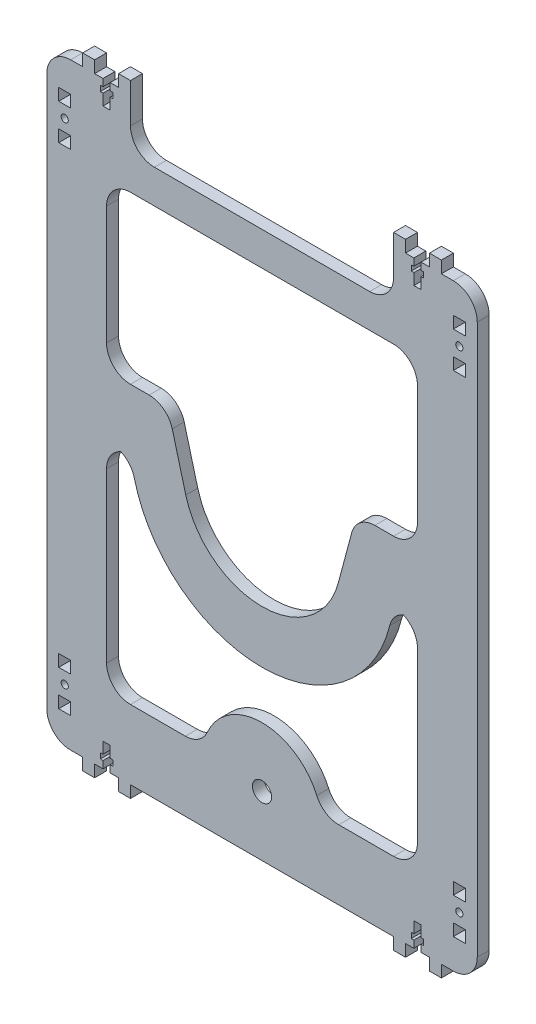
from build123d import *

# Parameters (mm, degrees)
SKETCH1_W           = 5
SKETCH1_H           = 5
SKETCH1_R           = 1.5
SKETCH1_R_2         = 4
BOSS_EXTRUDE1_DEPTH = 5
FILLET1_R           = 10


with BuildPart() as part:
    # Sketch1 → Boss-Extrude1 (new body)
    with BuildSketch(Plane.XY):
        Polygon((-75, 125), (-90, 125), (-90, -125), (-75, -125), (-75, -130), (-70, -130), (-70, -125), (-66.5, -125), (-66.5, -122), (-67.6, -122), (-67.6, -119.7), (-66.5, -119.7), (-66.5, -115), (-63.5, -115), (-63.5, -119.7), (-62.4, -119.7), (-62.4, -122), (-63.5, -122), (-63.5, -125), (-60, -125), (-60, -130), (-55, -130), (-55, -125), (55, -125), (55, -130), (60, -130), (60, -125), (63.5, -125), (63.5, -122), (62.4, -122), (62.4, -119.7), (63.5, -119.7), (63.5, -115), (66.5, -115), (66.5, -119.7), (67.6, -119.7), (67.6, -122), (66.5, -122), (66.5, -125), (70, -125), (70, -130), (75, -130), (75, -125), (90, -125), (90, 125), (75, 125), (75, 130), (70, 130), (70, 125), (66.5, 125), (66.5, 122), (67.6, 122), (67.6, 119.7), (66.5, 119.7), (66.5, 115), (63.5, 115), (63.5, 119.7), (62.4, 119.7), (62.4, 122), (63.5, 122), (63.5, 125), (60, 125), (60, 130), (55, 130), (55, 103.598832104), (-55, 103.598832104), (-55, 130), (-60, 130), (-60, 125), (-63.5, 125), (-63.5, 122), (-62.4, 122), (-62.4, 119.7), (-63.5, 119.7), (-63.5, 115), (-66.5, 115), (-66.5, 119.7), (-67.6, 119.7), (-67.6, 122), (-66.5, 122), (-66.5, 125), (-70, 125), (-70, 130), (-75, 130), align=None)
        with Locations((-82.5, -110)):
            Rectangle(SKETCH1_W, SKETCH1_H, mode=Mode.SUBTRACT)
        with Locations((-82.5, -102.5)):
            Circle(SKETCH1_R, mode=Mode.SUBTRACT)
        with Locations((-82.5, -95)):
            Rectangle(SKETCH1_W, SKETCH1_H, mode=Mode.SUBTRACT)
        with Locations((0, -100)):
            Circle(SKETCH1_R_2, mode=Mode.SUBTRACT)
        with Locations((82.5, -110)):
            Rectangle(SKETCH1_W, SKETCH1_H, mode=Mode.SUBTRACT)
        with Locations((82.5, -102.5)):
            Circle(SKETCH1_R, mode=Mode.SUBTRACT)
        with Locations((82.5, -95)):
            Rectangle(SKETCH1_W, SKETCH1_H, mode=Mode.SUBTRACT)
        with BuildLine():
            Line((-65, -5.570672252), (-54.717160111, -5.570672252))
            ThreePointArc((-54.717160111, -5.570672252), (0, -55), (54.717160111, -5.570672252))
            Line((54.717160111, -5.570672252), (65, -5.570672252))
            Line((65, -5.570672252), (65, -95.958016924))
            Line((65, -95.958016924), (24.671083738, -95.958016924))
            ThreePointArc((24.671083738, -95.958016924), (0, -75), (-24.671083738, -95.958016924))
            Line((-24.671083738, -95.958016924), (-65, -95.958016924))
            Line((-65, -95.958016924), (-65, -5.570672252))
        make_face(mode=Mode.SUBTRACT)
        with Locations((-82.5, 95)):
            Rectangle(SKETCH1_W, SKETCH1_H, mode=Mode.SUBTRACT)
        with Locations((-82.5, 102.5)):
            Circle(SKETCH1_R, mode=Mode.SUBTRACT)
        with Locations((-82.5, 110)):
            Rectangle(SKETCH1_W, SKETCH1_H, mode=Mode.SUBTRACT)
        with BuildLine():
            ThreePointArc((31.875552268, -8.541028488), (0, -33), (-31.875552268, -8.541028488))
            Line((-31.875552268, -8.541028488), (-39.523097802, 20))
            Line((-39.523097802, 20), (-65, 20))
            Line((-65, 20), (-65, 89.539551807))
            Line((-65, 89.539551807), (65, 89.539551807))
            Line((65, 89.539551807), (65, 20))
            Line((65, 20), (39.523097802, 20))
            Line((39.523097802, 20), (31.875552268, -8.541028488))
        make_face(mode=Mode.SUBTRACT)
        with Locations((82.5, 95)):
            Rectangle(SKETCH1_W, SKETCH1_H, mode=Mode.SUBTRACT)
        with Locations((82.5, 102.5)):
            Circle(SKETCH1_R, mode=Mode.SUBTRACT)
        with Locations((82.5, 110)):
            Rectangle(SKETCH1_W, SKETCH1_H, mode=Mode.SUBTRACT)
    extrude(amount=BOSS_EXTRUDE1_DEPTH)

    # Fillet1
    # the kernel refuses this fillet: 10 mm, written as the material it adds along each edge
    with BuildSketch(Plane(origin=(-55, 103.598832104, 0), x_dir=(1, 0, 0), z_dir=(0, 0, 1)), Plane(origin=(55, 103.598832104, 0), x_dir=(0, 1, 0), z_dir=(0, 0, 1)), Plane(origin=(-65, -95.958016924, 0), x_dir=(1, 0, 0), z_dir=(0, 0, 1)), Plane(origin=(65, -95.958016924, 0), x_dir=(0, 1, 0), z_dir=(0, 0, 1)), Plane(origin=(65, -5.570672252, 0), x_dir=(-1, 0, 0), z_dir=(0, 0, 1)), Plane(origin=(-65, -5.570672252, 0), x_dir=(0, -1, 0), z_dir=(0, 0, 1)), Plane(origin=(65, 89.539551807, 0), x_dir=(-1, 0, 0), z_dir=(0, 0, 1)), Plane(origin=(-65, 89.539551807, 0), x_dir=(0, -1, 0), z_dir=(0, 0, 1)), Plane(origin=(65, 20, 0), x_dir=(0, 1, 0), z_dir=(0, 0, 1)), Plane(origin=(-65, 20, 0), x_dir=(1, 0, 0), z_dir=(0, 0, 1))) as fillet1_piece_1:
        with BuildLine():
            CenterArc((FILLET1_R, FILLET1_R), FILLET1_R, 180, 90)
            Line((0, FILLET1_R), (0, 0))
            Line((0, 0), (FILLET1_R, 0))
        make_face()
    extrude(amount=5)
    with BuildSketch(Plane(origin=(24.671083738, -95.958016924, 0), x_dir=(1, 0, 0), z_dir=(0, 0, 1))) as fillet1_piece_2:
        with BuildLine():
            CenterArc((7.388590485, 10), FILLET1_R, 203.653187484, 66.346812516)
            ThreePointArc((-1.771316436, 5.988004835), (-0.697963006, 3.049524687), (0, 0))
            Line((0, 0), (7.388590485, 0))
        make_face()
    extrude(amount=5)
    with BuildSketch(Plane(origin=(-24.671083738, -95.958016924, 0), x_dir=(-1, 0, 0), z_dir=(0, 0, 1))) as fillet1_piece_3:
        with BuildLine():
            CenterArc((7.388590485, -10), FILLET1_R, 90, 66.346812516)
            ThreePointArc((-1.771316436, -5.988004835), (-0.697963006, -3.049524687), (0, 0))
            Line((0, 0), (7.388590485, 0))
        make_face()
    extrude(amount=5)
    with BuildSketch(Plane(origin=(54.717160111, -5.570672252, 0), x_dir=(-0.17083790481511615, -0.9852991476086749, 0), z_dir=(0, 0, 1))) as fillet1_piece_4:
        with BuildLine():
            CenterArc((8.419606625, 9.975355126), FILLET1_R, 189.836540175, 76.140088059)
            Line((-1.433384851, 8.266976078), (0, 0))
            ThreePointArc((0, 0), (3.85898637, 0.135546807), (7.717972739, 0))
        make_face()
    extrude(amount=5)
    with BuildSketch(Plane(origin=(-54.717160111, -5.570672252, 0), x_dir=(-1, 0, 0), z_dir=(0, 0, 1))) as fillet1_piece_5:
        with BuildLine():
            CenterArc((8.390320948, 10), FILLET1_R, 193.859911941, 76.140088059)
            ThreePointArc((-1.318522292, 7.604511961), (-0.525706993, 3.825412513), (0, 0))
            Line((0, 0), (8.390320948, 0))
        make_face()
    extrude(amount=5)
    # the kernel refuses this fillet: 10 mm, written as the material it takes off along each edge
    with BuildSketch(Plane(origin=(-90, -125, -25), x_dir=(0, 1, 0), z_dir=(0, 0, 1)), Plane(origin=(90, -125, -25), x_dir=(-1, 0, 0), z_dir=(0, 0, 1)), Plane(origin=(-90, 125, -25), x_dir=(1, 0, 0), z_dir=(0, 0, 1)), Plane(origin=(90, 125, -25), x_dir=(0, -1, 0), z_dir=(0, 0, 1))) as fillet1_2_piece_1:
        with BuildLine():
            CenterArc((FILLET1_R, -FILLET1_R), FILLET1_R, 90, 90)
            Line((0, -FILLET1_R), (0, 0))
            Line((0, 0), (FILLET1_R, 0))
        make_face()
    extrude(amount=55, mode=Mode.SUBTRACT)
    with BuildSketch(Plane(origin=(39.523097802, 20, -19.183174699), x_dir=(1, 0, 0), z_dir=(0, 0, 1)), Plane(origin=(-39.523097802, 20, -19.183174699), x_dir=(0.2588190451025106, -0.9659258262890711, 0), z_dir=(0, 0, 1))) as fillet1_2_piece_2:
        with BuildLine():
            CenterArc((FILLET1_R * 0.767326987979, -FILLET1_R), FILLET1_R, 90, 75)
            Line((-FILLET1_R * 0.19859883831, -FILLET1_R * 0.741180954897), (0, 0))
            Line((0, 0), (FILLET1_R * 0.767326987979, 0))
        make_face()
    extrude(amount=43.366349399, mode=Mode.SUBTRACT)


solid = part.part
